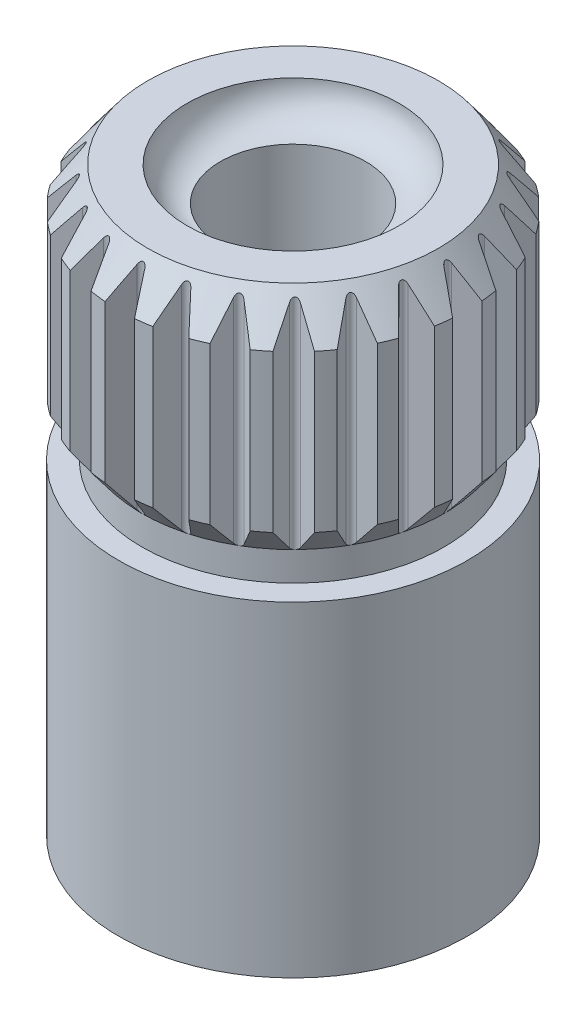
from build123d import *

# Parameters (mm, degrees)
KES_EKSTR_ZYON2_REACH   = 12.863
DAIRESEL_KAPLAMA1_COUNT = 24
IZIM7_R                 = 1.25
KES_EKSTR_ZYON3_DEPTH   = 9
IZIM10_R                = 1.825
KES_EKSTR_ZYON4_DEPTH   = 0.58
RADYUS3_R               = 0.58


with BuildPart() as part:
    # Çizim1 → Döndür2 (revolve)
    with BuildSketch(Plane(origin=(0, 0, 0), x_dir=(0, 0, -1), z_dir=(1, 0, 0)), mode=Mode.PRIVATE) as d_nd_r2_sk:
        Polygon((0, 0), (0, 10), (-2.5, 10), (-3, 9.33), (-3, 6.63), (-2.6, 6.1), (-2.6, 5.6), (-3, 5.6), (-3, 0), align=None)
    revolve(d_nd_r2_sk.sketch.rotate(Axis((0, 0, 0), (0, 1, 0)), 180), axis=Axis((0, 0, 0), (0, 1, 0)))

    # Kes-Ekstrüzyon2: up to this cone (the profile starts inside it)
    kes_ekstr_zyon2_end = Plane(origin=(0, 10, 0), z_dir=(0, 1, 0)).offset(-7.344999) * Cone(1e-06, 19.812374511, 26.251395226, align=(Align.CENTER, Align.CENTER, Align.MIN), mode=Mode.PRIVATE)
    # Çizim6 → Kes-Ekstrüzyon2 (cut, up to the surface)
    with BuildSketch(Plane(origin=(0, 10, 0), x_dir=(1, 0, 0), z_dir=(0, 1, 0)), mode=Mode.PRIVATE) as kes_ekstr_zyon2_sk1:
        with BuildLine():
            Line((-0.260611103, 2.988658872), (-0.089042861, 2.641374226))
            ThreePointArc((-0.089042861, 2.641374226), (-0.023242258, 2.600250475), (0.0429845, 2.640684357))
            Line((0.0429845, 2.640684357), (0.244665716, 2.990006469))
            ThreePointArc((0.244665716, 2.990006469), (-0.008001115, 2.99998933), (-0.260611103, 2.988658872))
        make_face()
    kes_ekstr_zyon2_tool1 = extrude(kes_ekstr_zyon2_sk1.sketch, amount=-KES_EKSTR_ZYON2_REACH, mode=Mode.PRIVATE) & kes_ekstr_zyon2_end
    kes_ekstr_zyon2 = kes_ekstr_zyon2_tool1.solids().sort_by_distance((-0.014025, 10, -2.84624))[0]
    add(kes_ekstr_zyon2, mode=Mode.SUBTRACT)

    # Dairesel Kaplama1: Kes-Ekstrüzyon2 ×24 about axis
    dairesel_kaplama1_axis = Axis((0, 0, 0), (0, 1, 0))
    for i in range(1, DAIRESEL_KAPLAMA1_COUNT):
        add(kes_ekstr_zyon2.rotate(dairesel_kaplama1_axis, i * 360 / DAIRESEL_KAPLAMA1_COUNT), mode=Mode.SUBTRACT)

    # Çizim7 → Kes-Ekstrüzyon3 (cut)
    with BuildSketch(Plane(origin=(0, 10, 0), x_dir=(1, 0, 0), z_dir=(0, 1, 0))):
        with Locations(Location((0, 0, 0), (0, 0, 270))):
            Circle(IZIM7_R)
    extrude(amount=-KES_EKSTR_ZYON3_DEPTH, mode=Mode.SUBTRACT)

    # Çizim10 → Kes-Ekstrüzyon4 (cut)
    with BuildSketch(Plane(origin=(0, 10, 0), x_dir=(1, 0, 0), z_dir=(0, 1, 0))):
        with Locations(Location((0, 0, 0), (0, 0, 270))):
            Circle(IZIM10_R)
    extrude(amount=-KES_EKSTR_ZYON4_DEPTH, mode=Mode.SUBTRACT)

    # Radyus3
    # the kernel refuses this fillet: 0.58 mm, written as the material it adds along each edge
    with BuildSketch(Plane(origin=(0, 9.42, 0), x_dir=(0, 0, 1), z_dir=(-1, 0, 0))) as radyus3_piece_1_section:
        with BuildLine():
            CenterArc((1.825 - RADYUS3_R, RADYUS3_R), RADYUS3_R, 270, 90)
            Line((1.825 - RADYUS3_R, 0), (1.825, 0))
            Line((1.825, 0), (1.825, RADYUS3_R))
        make_face()
    radyus3_piece_1 = revolve(axis=Axis((0, 9.42, 0), (0, 1, 0)), mode=Mode.PRIVATE)
    radyus3_piece_1 = radyus3_piece_1 - Plane(origin=(0, 9.584820973, 0), x_dir=(0, 0, 1), z_dir=(0, 1, 0)) * Cylinder(1.25, 8, mode=Mode.PRIVATE)
    add(radyus3_piece_1)


solid = part.part
